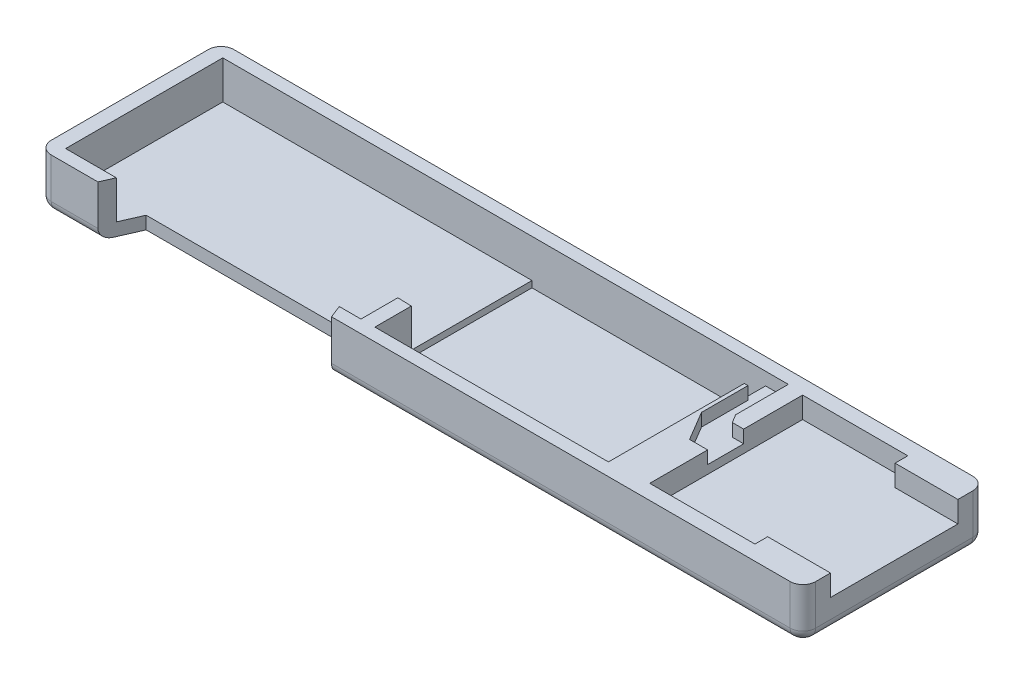
from build123d import *

# Parameters (mm, degrees)
SKETCH_3_W          = 180
SKETCH_3_H          = 43
EXTRUDE_1_DEPTH     = 12
CUT_EXTRUDE_1_DEPTH = 52
CUT_EXTRUDE_2_DEPTH = 5
CUT_EXTRUDE_3_DEPTH = 5
SKETCH_8_W          = 55
SKETCH_8_H          = 37
CUT_EXTRUDE_4_DEPTH = 10.5
CUT_EXTRUDE_5_DEPTH = 3
SKETCH_10_W         = 62.128790526
SKETCH_10_H         = 8.683746703
CUT_EXTRUDE_6_DEPTH = 8
CUT_EXTRUDE_8_DEPTH = 9
FILLET_3_R          = 3
FILLET_4_R          = 2.5


with BuildPart() as part:
    # 草图3 → 凸台-拉伸1 (new body)
    with BuildSketch(Plane(origin=(0, 0, 0), x_dir=(1, 0, 0), z_dir=(0, 1, 0))):
        with Locations((50.068597249, 7.753123643)):
            Rectangle(SKETCH_3_W, SKETCH_3_H)
    extrude(amount=EXTRUDE_1_DEPTH)

    # 草图4 → 切除-拉伸1 (cut)
    with BuildSketch(Plane(origin=(0, 0, 0), x_dir=(1, 0, 0), z_dir=(0, 1, 0))):
        Polygon((-22.469613434, -5.858946979), (26.002261286, -5.858946979), (29.068597249, -13.746876357), (-25.931402751, -13.746876357), align=None)
    extrude(amount=CUT_EXTRUDE_1_DEPTH, mode=Mode.SUBTRACT)

    # 草图5 → 切除-拉伸2 (cut)
    with BuildSketch(Plane(origin=(0, 12, 0), x_dir=(1, 0, 0), z_dir=(0, 1, 0))):
        Polygon((140.068597249, 7.753123643), (140.068597249, 22.753123643), (125.276479966, 22.753123643), (125.276479966, -7.246876357), (140.068597249, -7.246876357), align=None)
    extrude(amount=-CUT_EXTRUDE_2_DEPTH, mode=Mode.SUBTRACT)

    # 草图7 → 切除-拉伸3 (cut)
    with BuildSketch(Plane(origin=(0, 12, 0), x_dir=(1, 0, 0), z_dir=(0, 1, 0))):
        Polygon((125.276479966, 7.753123643), (125.276479966, 25.753123643), (100.500825538, 25.753123643), (100.500825538, -10.246876357), (125.276479966, -10.246876357), align=None)
    extrude(amount=-CUT_EXTRUDE_3_DEPTH, mode=Mode.SUBTRACT)

    # 草图8 → 切除-拉伸4 (cut)
    with BuildSketch(Plane(origin=(0, 12, 0), x_dir=(1, 0, 0), z_dir=(0, 1, 0))):
        with Locations((63.776287419, 7.753123643)):
            Rectangle(SKETCH_8_W, SKETCH_8_H)
    extrude(amount=-CUT_EXTRUDE_4_DEPTH, mode=Mode.SUBTRACT)

    # 草图9 → 切除-拉伸5 (cut)
    with BuildSketch(Plane(origin=(0, 12, 0), x_dir=(1, 0, 0), z_dir=(0, 1, 0))):
        Polygon((91.276287419, 26.253123643), (96.635770173, 26.253123643), (96.635770173, 22.130591531), (96.635770173, 13.862098754), (97.813575381, 11.877191358), (100.500825538, 11.877191358), (100.500825538, 3.393971617), (96.236747254, 3.393971617), (92.132656028, 10.310430274), (92.132656028, 21.255120764), (91.276287419, 21.255120764), align=None)
    extrude(amount=-CUT_EXTRUDE_5_DEPTH, mode=Mode.SUBTRACT)

    # 草图10 → 切除-拉伸6 (cut)
    with BuildSketch(Plane(origin=(0, 12, 0), x_dir=(1, 0, 0), z_dir=(0, 1, 0))):
        with Locations((1.934159822, -6.405003006)):
            Rectangle(SKETCH_10_W, SKETCH_10_H)
    extrude(amount=-CUT_EXTRUDE_6_DEPTH, mode=Mode.SUBTRACT)

    # 草图11 → 切除-拉伸8 (cut)
    with BuildSketch(Plane(origin=(0, 12, 0), x_dir=(1, 0, 0), z_dir=(0, 1, 0))):
        Polygon((32.998555085, -10.746876357), (-36.5396752, -10.746876357), (-36.5396752, 26.253123643), (36.276287419, 26.253123643), (36.276287419, -2.167243749), (32.998555085, -2.063129654), align=None)
    extrude(amount=-CUT_EXTRUDE_8_DEPTH, mode=Mode.SUBTRACT)

    # 圆角3
    fillet_3_edges = [part.edges().sort_by_distance(p)[0] for p in [
        (140.068597249, 6, -29.253123643),
        (140.068597249, 6, 13.746876357),
        (-39.931402751, 6, 13.746876357),
        (-39.931402751, 6, -29.253123643),
    ]]
    fillet(fillet_3_edges, radius=FILLET_3_R)

    # 圆角4
    fillet_4_edges = [part.edges().sort_by_distance(p)[0] for p in [
        (50.068597249, 0, -29.253123643),
        (-39.052723094, 0, 12.8681967),
        (-31.431402751, 0, 13.746876357),
        (83.068597249, 0, 13.746876357),
        (139.189917593, 0, 12.8681967),
        (140.068597249, 0, -7.753123643),
        (139.189917593, 0, -28.374443987),
        (-39.052723094, 0, -28.374443987),
        (-39.931402751, 0, -7.753123643),
    ]]
    fillet(fillet_4_edges, radius=FILLET_4_R)


solid = part.part
